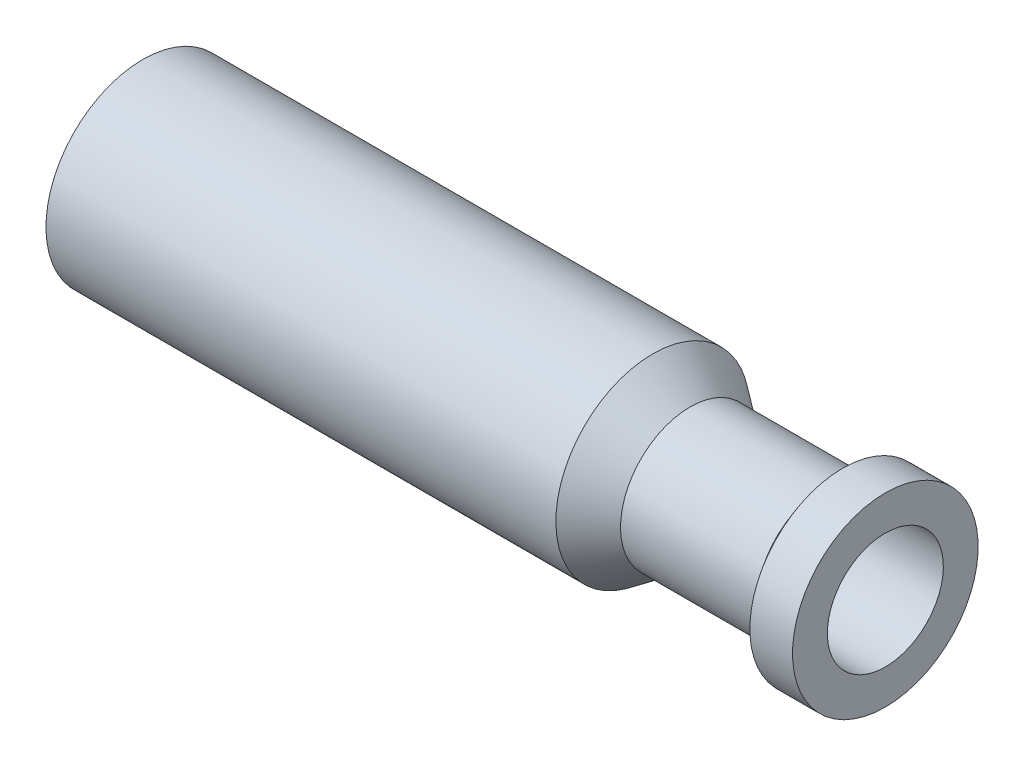
from build123d import *

# Parameters (mm, degrees)
SKETCH4_R          = 15.875
CUT_EXTRUDE1_DEPTH = 190.5


with BuildPart() as part:
    # Sketch1 → Revolve1 (revolve)
    with BuildSketch(Plane.XY):
        Polygon((107.503032851, -15.910925594), (117.715228697, -23.386149331), (154.81866926, -23.386149331), (159.466804827, -17.036149331), (171.145497316, -17.036149331), (171.145497316, -42.436149331), (-32.054502684, -42.436149331), (-32.054502684, -15.910925594), align=None)
    revolve(axis=Axis((171.145497316, -42.436149331, 0), (-1, 0, 0)))

    # Sketch4 → Cut-Extrude1 (cut)
    with BuildSketch(Plane(origin=(171.145497316, 0, 0), x_dir=(0, 0, -1), z_dir=(1, 0, 0))):
        with Locations((0, -42.436149331)):
            Circle(SKETCH4_R)
    extrude(amount=-CUT_EXTRUDE1_DEPTH, mode=Mode.SUBTRACT)


solid = part.part
